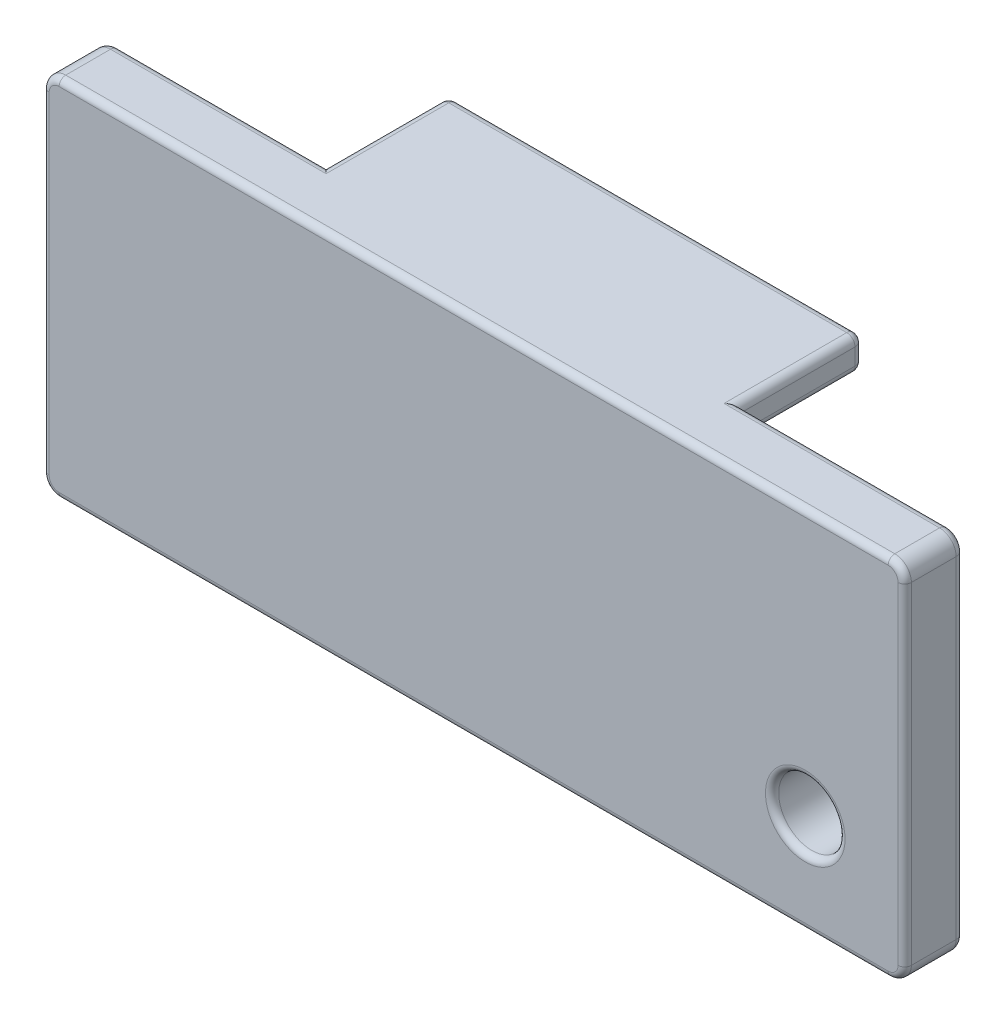
from build123d import *

# Parameters (mm, degrees)
SKETCH1_W           = 26
SKETCH1_H           = 11
BOSS_EXTRUDE1_DEPTH = 1.8
FILLET1_R           = 0.2
SKETCH2_R           = 1
CUT_EXTRUDE1_DEPTH  = 153.699256387
FILLET2_R           = 0.5
FILLET3_R           = 0.2
SKETCH4_W           = 12.5
SKETCH4_H           = 1
BOSS_EXTRUDE2_DEPTH = 3.7
FILLET4_R           = 0.25
FILLET5_R           = 0.25


with BuildPart() as part:
    # Sketch1 → Boss-Extrude1 (new body)
    with BuildSketch(Plane.XY.offset(13.74095281)):
        with Locations((74.443158301, -119.669952335)):
            Rectangle(SKETCH1_W, SKETCH1_H)
    extrude(amount=-BOSS_EXTRUDE1_DEPTH)

    # Fillet1
    fillet1_edges = [part.edges().sort_by_distance(p)[0] for p in [
        (87.443158301, -119.669952335, 13.74095281),
        (74.443158301, -114.169952335, 13.74095281),
        (61.443158301, -119.669952335, 13.74095281),
        (74.443158301, -125.169952335, 13.74095281),
    ]]
    fillet(fillet1_edges, radius=FILLET1_R)

    # Sketch2 → Cut-Extrude1 (cut, through all)
    with BuildSketch(Plane.XY.offset(13.74095281)):
        with Locations((84.443158301, -122.169952335)):
            Circle(SKETCH2_R)
    extrude(amount=-CUT_EXTRUDE1_DEPTH, mode=Mode.SUBTRACT)

    # Fillet2
    # the kernel refuses this fillet: 0.5 mm, written as the material it takes off along each edge
    with BuildSketch(Plane(origin=(86.943158301, -124.669952335, 13.74095281), x_dir=(0, -1, 0), z_dir=(-1, 0, 0))) as fillet2_piece_1:
        with BuildLine():
            CenterArc((0.3, -0.2), 0.2, 0, 90)
            Line((0.5, -0.2), (0.5, 0))
            Line((0.5, 0), (0.3, 0))
        make_face()
    revolve(axis=Axis((86.943158301, -124.669952335, 13.74095281), (0, 0, 1)), revolution_arc=90, mode=Mode.SUBTRACT)
    with BuildSketch(Plane(origin=(61.943158301, -124.669952335, 13.74095281), x_dir=(-1, 0, 0), z_dir=(0, 1, 0))) as fillet2_piece_2:
        with BuildLine():
            CenterArc((0.3, -0.2), 0.2, 0, 90)
            Line((0.5, -0.2), (0.5, 0))
            Line((0.5, 0), (0.3, 0))
        make_face()
    revolve(axis=Axis((61.943158301, -124.669952335, 13.74095281), (0, 0, 1)), revolution_arc=90, mode=Mode.SUBTRACT)
    with BuildSketch(Plane(origin=(86.943158301, -114.669952335, 13.74095281), x_dir=(1, 0, 0), z_dir=(0, -1, 0))) as fillet2_piece_3:
        with BuildLine():
            CenterArc((0.3, -0.2), 0.2, 0, 90)
            Line((0.5, -0.2), (0.5, 0))
            Line((0.5, 0), (0.3, 0))
        make_face()
    revolve(axis=Axis((86.943158301, -114.669952335, 13.74095281), (0, 0, 1)), revolution_arc=90, mode=Mode.SUBTRACT)
    with BuildSketch(Plane(origin=(61.943158301, -114.669952335, 13.74095281), x_dir=(0, 1, 0), z_dir=(1, 0, 0))) as fillet2_piece_4:
        with BuildLine():
            CenterArc((0.3, -0.2), 0.2, 0, 90)
            Line((0.5, -0.2), (0.5, 0))
            Line((0.5, 0), (0.3, 0))
        make_face()
    revolve(axis=Axis((61.943158301, -114.669952335, 13.74095281), (0, 0, 1)), revolution_arc=90, mode=Mode.SUBTRACT)
    with BuildSketch(Plane(origin=(87.443158301, -125.169952335, 13.74095281), x_dir=(-1, 0, 0), z_dir=(0, 0, -1)), Plane(origin=(87.443158301, -114.169952335, 13.74095281), x_dir=(0, -1, 0), z_dir=(0, 0, -1))) as fillet2_piece_5:
        with BuildLine():
            CenterArc((FILLET2_R, FILLET2_R), FILLET2_R, 180, 90)
            Line((0, FILLET2_R), (0, 0))
            Line((0, 0), (FILLET2_R, 0))
        make_face()
    extrude(amount=3.05, mode=Mode.SUBTRACT)
    with BuildSketch(Plane(origin=(61.443158301, -114.169952335, 13.74095281), x_dir=(0, -1, 0), z_dir=(0, 0, -1)), Plane(origin=(61.443158301, -125.169952335, 13.74095281), x_dir=(1, 0, 0), z_dir=(0, 0, -1))) as fillet2_piece_6:
        with BuildLine():
            CenterArc((FILLET2_R, -FILLET2_R), FILLET2_R, 90, 90)
            Line((0, -FILLET2_R), (0, 0))
            Line((0, 0), (FILLET2_R, 0))
        make_face()
    extrude(amount=3.05, mode=Mode.SUBTRACT)

    # Fillet3
    fillet3_edges = [part.edges().sort_by_distance(p)[0] for p in [
        (83.443158301, -122.169952335, 11.94095281),
        (83.443158301, -122.169952335, 13.74095281),
    ]]
    fillet(fillet3_edges, radius=FILLET3_R)

    # Sketch4 → Boss-Extrude2 (add)
    with BuildSketch(Plane(origin=(0, 0, 11.94095281), x_dir=(-1, 0, 0), z_dir=(0, 0, -1))):
        with Locations((-74.443158301, -124.669952335)):
            Rectangle(SKETCH4_W, SKETCH4_H)
        with Locations((-74.443158301, -114.669952335)):
            Rectangle(SKETCH4_W, SKETCH4_H)
    extrude(amount=BOSS_EXTRUDE2_DEPTH)

    # Fillet4
    fillet4_edges = [part.edges().sort_by_distance(p)[0] for p in [
        (61.443158301, -119.669952335, 11.94095281),
        (65.068158301, -125.169952335, 11.94095281),
        (83.818158301, -114.169952335, 11.94095281),
        (87.443158301, -119.669952335, 11.94095281),
        (87.296711691, -125.023505725, 11.94095281),
        (87.296711691, -114.316398944, 11.94095281),
        (61.58960491, -114.316398944, 11.94095281),
        (61.58960491, -125.023505725, 11.94095281),
        (83.818158301, -125.169952335, 11.94095281),
        (65.068158301, -114.169952335, 11.94095281),
        (74.443158301, -125.169952335, 8.24095281),
        (74.443158301, -124.169952335, 8.24095281),
        (74.443158301, -114.169952335, 8.24095281),
        (74.443158301, -115.169952335, 8.24095281),
    ]]
    fillet(fillet4_edges, radius=FILLET4_R)

    # Fillet5
    fillet5_edges = [part.edges().sort_by_distance(p)[0] for p in [
        (68.193158301, -114.169952335, 10.34095281),
        (68.193158301, -114.243175639, 8.314176115),
        (68.193158301, -115.169952335, 10.21595281),
        (68.193158301, -115.09672903, 8.314176115),
        (68.193158301, -125.169952335, 10.34095281),
        (68.193158301, -125.09672903, 8.314176115),
        (68.193158301, -124.169952335, 10.21595281),
        (68.193158301, -124.243175639, 8.314176115),
        (80.693158301, -125.169952335, 10.34095281),
        (80.693158301, -125.09672903, 8.314176115),
        (80.693158301, -124.169952335, 10.21595281),
        (80.693158301, -124.243175639, 8.314176115),
        (80.693158301, -114.169952335, 10.34095281),
        (80.693158301, -114.243175639, 8.314176115),
        (80.693158301, -115.169952335, 10.21595281),
        (80.693158301, -115.09672903, 8.314176115),
        (68.193158301, -114.669952335, 8.24095281),
        (68.193158301, -124.669952335, 8.24095281),
        (80.693158301, -124.669952335, 8.24095281),
        (80.693158301, -114.669952335, 8.24095281),
    ]]
    fillet(fillet5_edges, radius=FILLET5_R)


solid = part.part
